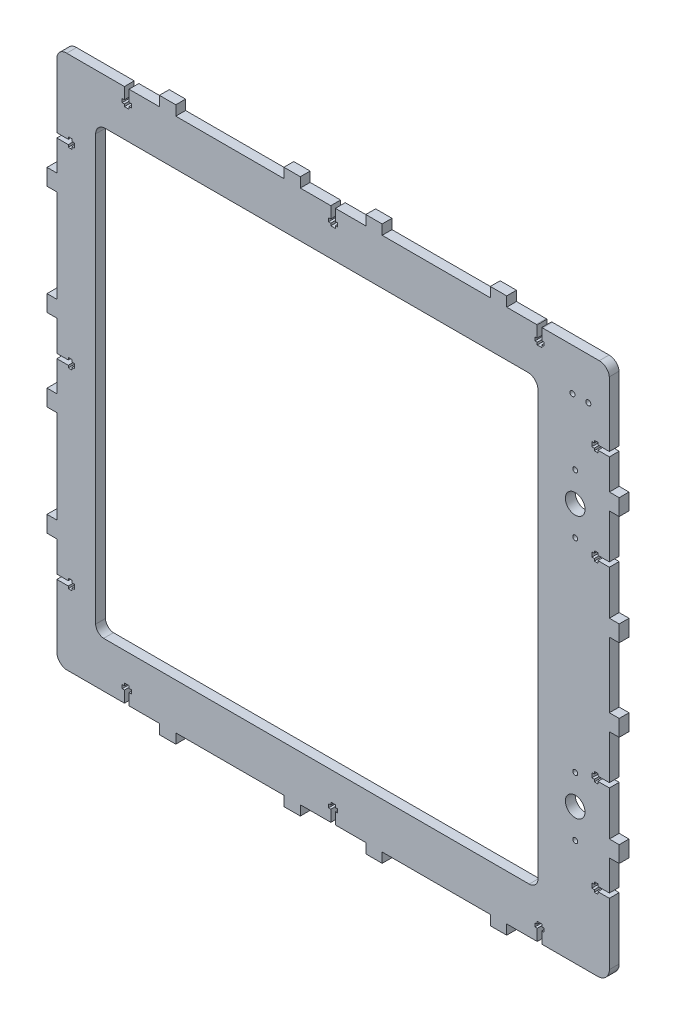
from build123d import *

# Parameters (mm, degrees)
SKETCH_1_R      = 1.5
SKETCH_1_R_2    = 6
SKETCH_1_R_3    = 1.55
EXTRUDE_1_DEPTH = 6


with BuildPart() as part:
    # Эскиз1 → Бобышка-Вытянуть1 (new body)
    with BuildSketch(Plane.XY):
        with BuildLine():
            Line((-163.054352241, 162.505990171), (-127.786008344, 162.499306348))
            Line((-127.786008344, 162.499306348), (-127.787158908, 155.488675728))
            Line((-127.787158908, 155.488675728), (-129.185759975, 155.487133536))
            Line((-129.185759975, 155.487133536), (-129.184934777, 153.288647673))
            Line((-129.184934777, 153.288647673), (-127.786008344, 153.287943858))
            Line((-127.786008344, 153.287943858), (-127.784901099, 151.845327951))
            Line((-127.784901099, 151.845327951), (-124.985164527, 151.845779168))
            Line((-124.985164527, 151.845779168), (-124.984829288, 153.288647673))
            Line((-124.984829288, 153.288647673), (-123.585765673, 153.289035216))
            Line((-123.585765673, 153.289035216), (-123.585937007, 155.488675728))
            Line((-123.585937007, 155.488675728), (-124.985164527, 155.48922606))
            Line((-124.985164527, 155.48922606), (-124.984345552, 162.505990171))
            Line((-124.984345552, 162.505990171), (-106.406283565, 162.506109778))
            Line((-106.406283565, 162.506109778), (-106.406283565, 168.545752435))
            Line((-106.406283565, 168.545752435), (-96.406283565, 168.543859512))
            Line((-96.406283565, 168.543859512), (-96.406283565, 162.506020098))
            Line((-96.406283565, 162.506020098), (-30.331510863, 162.505990171))
            Line((-30.331510863, 162.505990171), (-30.331510863, 168.530758948))
            Line((-30.331510863, 168.530758948), (-20.331510863, 168.528865986))
            Line((-20.331510863, 168.528865986), (-20.331510863, 162.506735802))
            Line((-20.331510863, 162.506735802), (-1.712216453, 162.505990171))
            Line((-1.712216453, 162.505990171), (-1.708948783, 155.490356789))
            Line((-1.708948783, 155.490356789), (-3.108615484, 155.488675728))
            Line((-3.108615484, 155.488675728), (-3.109053192, 153.2895174))
            Line((-3.109053192, 153.2895174), (-1.709631525, 153.288647673))
            Line((-1.709631525, 153.288647673), (-1.708948783, 151.846178834))
            Line((-1.708948783, 151.846178834), (1.089931679, 151.845327951))
            Line((1.089931679, 151.845327951), (1.091895035, 153.287461297))
            Line((1.091895035, 153.287461297), (2.489960994, 153.288647673))
            Line((2.489960994, 153.288647673), (2.491293888, 155.486272288))
            Line((2.491293888, 155.486272288), (1.093632949, 155.488675728))
            Line((1.093632949, 155.488675728), (1.091895035, 162.496160485))
            Line((1.091895035, 162.496160485), (19.663806989, 162.505990171))
            Line((19.663806989, 162.505990171), (19.663806989, 168.52090491))
            Line((19.663806989, 168.52090491), (29.663806989, 168.519014987))
            Line((29.663806989, 168.519014987), (29.663806989, 162.518962699))
            Line((29.663806989, 162.518962699), (95.737938155, 162.505990171))
            Line((95.737938155, 162.505990171), (95.737938155, 168.505911792))
            Line((95.737938155, 168.505911792), (105.737938155, 168.504023152))
            Line((105.737938155, 168.504023152), (105.737938155, 162.524311353))
            Line((105.737938155, 162.524311353), (123.808167212, 162.505990171))
            Line((123.808167212, 162.505990171), (123.97458239, 162.505990171))
            Line((123.97458239, 162.505990171), (124.213834206, 162.505990171))
            Line((124.213834206, 162.505990171), (124.364983924, 162.505990171))
            Line((124.364983924, 162.505990171), (124.366734945, 155.490356789))
            Line((124.366734945, 155.490356789), (122.967068244, 155.488675728))
            Line((122.967068244, 155.488675728), (122.966630536, 153.2895174))
            Line((122.966630536, 153.2895174), (124.366052203, 153.288647673))
            Line((124.366052203, 153.288647673), (124.366734945, 151.846178834))
            Line((124.366734945, 151.846178834), (127.165615407, 151.845327951))
            Line((127.165615407, 151.845327951), (127.167578763, 153.287461297))
            Line((127.167578763, 153.287461297), (128.565644722, 153.288647673))
            Line((128.565644722, 153.288647673), (128.566977616, 155.486272288))
            Line((128.566977616, 155.486272288), (127.169316677, 155.488675728))
            Line((127.169316677, 155.488675728), (127.167578763, 162.496160485))
            Line((127.167578763, 162.496160485), (127.50399944, 162.505990171))
            Line((127.50399944, 162.505990171), (127.664200029, 162.505990171))
            Line((127.664200029, 162.505990171), (162.305983406, 162.505150259))
            ThreePointArc((162.305983406, 162.505150259), (166.415523325, 160.937872534), (168.43795868, 157.032180144))
            Line((168.43795868, 157.032180144), (168.461169098, 117.507879349))
            Line((168.461169098, 117.507879349), (161.461167891, 117.507879349))
            Line((161.461167891, 117.507879349), (161.461167891, 118.907983373))
            Line((161.461167891, 118.907983373), (159.260345309, 118.907983373))
            Line((159.260345309, 118.907983373), (159.261167381, 117.508102408))
            Line((159.261167381, 117.508102408), (157.761167639, 117.507221542))
            Line((157.761167639, 117.507221542), (157.762811385, 114.708138736))
            Line((157.762811385, 114.708138736), (159.262811126, 114.709019602))
            Line((159.262811126, 114.709019602), (159.263633807, 113.308102347))
            Line((159.263633807, 113.308102347), (161.463634217, 113.308049007))
            Line((161.463634217, 113.308049007), (161.463668161, 114.708049007))
            Line((161.463668161, 114.708049007), (168.461169098, 114.706859071))
            Line((168.461169098, 114.706859071), (168.472661293, 96.114498827))
            Line((168.472661293, 96.114498827), (174.453093619, 96.097294997))
            Line((174.453093619, 96.097294997), (174.460484878, 86.097294997))
            Line((174.460484878, 86.097294997), (168.461169098, 86.097294997))
            Line((168.461169098, 86.097294997), (168.461169098, 59.120501996))
            Line((168.461169098, 59.120501996), (161.461167891, 59.120501996))
            Line((161.461167891, 59.120501996), (161.461167891, 60.52060602))
            Line((161.461167891, 60.52060602), (159.260345309, 60.52060602))
            Line((159.260345309, 60.52060602), (159.261167381, 59.120725056))
            Line((159.261167381, 59.120725056), (157.761167639, 59.11984419))
            Line((157.761167639, 59.11984419), (157.762811385, 56.320761383))
            Line((157.762811385, 56.320761383), (159.262811126, 56.32164225))
            Line((159.262811126, 56.32164225), (159.263633807, 54.920724995))
            Line((159.263633807, 54.920724995), (161.463634217, 54.920671654))
            Line((161.463634217, 54.920671654), (161.463668161, 56.320671654))
            Line((161.463668161, 56.320671654), (168.461169098, 56.319481719))
            Line((168.461169098, 56.319481719), (168.461169098, 29.331611336))
            Line((168.461169098, 29.331611336), (174.461169098, 29.315873812))
            Line((174.461169098, 29.315873812), (174.461169098, 19.315873812))
            Line((174.461169098, 19.315873812), (168.461169098, 19.315873812))
            Line((168.461169098, 19.315873812), (168.461169098, -20.682096265))
            Line((168.461169098, -20.682096265), (174.461169098, -20.682096265))
            Line((174.461169098, -20.682096265), (174.461169098, -30.682096265))
            Line((174.461169098, -30.682096265), (168.461169098, -30.682096265))
            Line((168.461169098, -30.682096265), (168.461169098, -57.65789376))
            Line((168.461169098, -57.65789376), (161.461167891, -57.65789376))
            Line((161.461167891, -57.65789376), (161.461167891, -56.257789736))
            Line((161.461167891, -56.257789736), (159.260345309, -56.257789736))
            Line((159.260345309, -56.257789736), (159.261167381, -57.6576707))
            Line((159.261167381, -57.6576707), (157.761167639, -57.658551566))
            Line((157.761167639, -57.658551566), (157.762811385, -60.457634372))
            Line((157.762811385, -60.457634372), (159.262811126, -60.456753506))
            Line((159.262811126, -60.456753506), (159.263633807, -61.857670761))
            Line((159.263633807, -61.857670761), (161.463634217, -61.857724102))
            Line((161.463634217, -61.857724102), (161.463668161, -60.457724102))
            Line((161.463668161, -60.457724102), (168.461169098, -60.458914037))
            Line((168.461169098, -60.458914037), (168.461169098, -87.470948662))
            Line((168.461169098, -87.470948662), (174.461169098, -87.470948662))
            Line((174.461169098, -87.470948662), (174.461169098, -97.470948662))
            Line((174.461169098, -97.470948662), (168.461169098, -97.470948662))
            Line((168.461169098, -97.470948662), (168.461169098, -116.041156567))
            Line((168.461169098, -116.041156567), (161.461167891, -116.041156567))
            Line((161.461167891, -116.041156567), (161.461167891, -114.641052543))
            Line((161.461167891, -114.641052543), (159.260345309, -114.641052543))
            Line((159.260345309, -114.641052543), (159.261167381, -116.040933507))
            Line((159.261167381, -116.040933507), (157.761167639, -116.041814374))
            Line((157.761167639, -116.041814374), (157.762811385, -118.84089718))
            Line((157.762811385, -118.84089718), (159.262811126, -118.840016313))
            Line((159.262811126, -118.840016313), (159.263633807, -120.240933568))
            Line((159.263633807, -120.240933568), (161.463634217, -120.240986909))
            Line((161.463634217, -120.240986909), (161.463668161, -118.840986909))
            Line((161.463668161, -118.840986909), (168.461169098, -118.842176844))
            Line((168.461169098, -118.842176844), (168.46054766, -156.584493379))
            ThreePointArc((168.46054766, -156.584493379), (166.275853581, -161.731495656), (161.058581619, -163.74261324))
            Line((161.058581619, -163.74261324), (127.196370063, -163.74261324))
            Line((127.196370063, -163.74261324), (127.196370063, -156.742612033))
            Line((127.196370063, -156.742612033), (128.596474087, -156.742612033))
            Line((128.596474087, -156.742612033), (128.596474087, -154.541789451))
            Line((128.596474087, -154.541789451), (127.196593122, -154.542611523))
            Line((127.196593122, -154.542611523), (127.195712256, -153.042611781))
            Line((127.195712256, -153.042611781), (124.39662945, -153.044255527))
            Line((124.39662945, -153.044255527), (124.397510316, -154.544255268))
            Line((124.397510316, -154.544255268), (122.996593061, -154.545077949))
            Line((122.996593061, -154.545077949), (122.996539721, -156.745078359))
            Line((122.996539721, -156.745078359), (124.396539721, -156.745112303))
            Line((124.396539721, -156.745112303), (124.395349786, -163.74261324))
            Line((124.395349786, -163.74261324), (105.737938155, -163.74261324))
            Line((105.737938155, -163.74261324), (105.737938155, -169.74305922))
            Line((105.737938155, -169.74305922), (95.737938155, -169.745257606))
            Line((95.737938155, -169.745257606), (95.737938155, -163.74261324))
            Line((95.737938155, -163.74261324), (29.663806989, -163.74261324))
            Line((29.663806989, -163.74261324), (29.663806989, -169.76003815))
            Line((29.663806989, -169.76003815), (19.663806989, -169.74261324))
            Line((19.663806989, -169.74261324), (19.663806989, -163.74261324))
            Line((19.663806989, -163.74261324), (1.127420747, -163.74261324))
            Line((1.127420747, -163.74261324), (1.127420747, -156.742612033))
            Line((1.127420747, -156.742612033), (2.527524771, -156.742612033))
            Line((2.527524771, -156.742612033), (2.527524771, -154.541789451))
            Line((2.527524771, -154.541789451), (1.127643807, -154.542611523))
            Line((1.127643807, -154.542611523), (1.126762941, -153.042611781))
            Line((1.126762941, -153.042611781), (-1.672319865, -153.044255527))
            Line((-1.672319865, -153.044255527), (-1.671438999, -154.544255268))
            Line((-1.671438999, -154.544255268), (-3.072356254, -154.545077949))
            Line((-3.072356254, -154.545077949), (-3.072409595, -156.745078359))
            Line((-3.072409595, -156.745078359), (-1.672409595, -156.745112303))
            Line((-1.672409595, -156.745112303), (-1.67359953, -163.74261324))
            Line((-1.67359953, -163.74261324), (-20.331510863, -163.74261324))
            Line((-20.331510863, -163.74261324), (-20.331510863, -169.74261324))
            Line((-20.331510863, -169.74261324), (-30.331510863, -169.74261324))
            Line((-30.331510863, -169.74261324), (-30.331510863, -163.74261324))
            Line((-30.331510863, -163.74261324), (-96.406283565, -163.74261324))
            Line((-96.406283565, -163.74261324), (-96.406283565, -169.74261324))
            Line((-96.406283565, -169.74261324), (-106.406283565, -169.74261324))
            Line((-106.406283565, -169.74261324), (-106.406283565, -163.74261324))
            Line((-106.406283565, -163.74261324), (-124.943599267, -163.74261324))
            Line((-124.943599267, -163.74261324), (-124.943599267, -156.742612033))
            Line((-124.943599267, -156.742612033), (-123.543495243, -156.742612033))
            Line((-123.543495243, -156.742612033), (-123.543495243, -154.541789451))
            Line((-123.543495243, -154.541789451), (-124.943376207, -154.542611523))
            Line((-124.943376207, -154.542611523), (-124.944257074, -153.042611781))
            Line((-124.944257074, -153.042611781), (-127.74333988, -153.044255527))
            Line((-127.74333988, -153.044255527), (-127.742459013, -154.544255268))
            Line((-127.742459013, -154.544255268), (-129.143376268, -154.545077949))
            Line((-129.143376268, -154.545077949), (-129.143429609, -156.745078359))
            Line((-129.143429609, -156.745078359), (-127.743429609, -156.745112303))
            Line((-127.743429609, -156.745112303), (-127.744619544, -163.74261324))
            Line((-127.744619544, -163.74261324), (-164.010580235, -163.74261324))
            ThreePointArc((-164.010580235, -163.74261324), (-167.651465832, -161.309829433), (-169.073914963, -157.168437946))
            Line((-169.073914963, -157.168437946), (-169.078575402, -118.896065743))
            Line((-169.078575402, -118.896065743), (-162.078574195, -118.896065743))
            Line((-162.078574195, -118.896065743), (-162.078574195, -120.296169767))
            Line((-162.078574195, -120.296169767), (-159.877751612, -120.296169767))
            Line((-159.877751612, -120.296169767), (-159.878573685, -118.896288803))
            Line((-159.878573685, -118.896288803), (-158.378573943, -118.895407936))
            Line((-158.378573943, -118.895407936), (-158.380217688, -116.09632513))
            Line((-158.380217688, -116.09632513), (-159.88021743, -116.097205997))
            Line((-159.88021743, -116.097205997), (-159.88104011, -114.696288742))
            Line((-159.88104011, -114.696288742), (-162.081040521, -114.696235401))
            Line((-162.081040521, -114.696235401), (-162.081074465, -116.096235401))
            Line((-162.081074465, -116.096235401), (-169.078575402, -116.095045466))
            Line((-169.078575402, -116.095045466), (-169.074467884, -97.470948662))
            Line((-169.074467884, -97.470948662), (-175.078575402, -97.470948662))
            Line((-175.078575402, -97.470948662), (-175.078575402, -87.470948662))
            Line((-175.078575402, -87.470948662), (-169.072240872, -87.470948662))
            Line((-169.072240872, -87.470948662), (-169.077597241, -30.682096265))
            Line((-169.077597241, -30.682096265), (-175.078575402, -30.682096265))
            Line((-175.078575402, -30.682096265), (-175.078575402, -20.682096265))
            Line((-175.078575402, -20.682096265), (-169.077941566, -20.682096265))
            Line((-169.077941566, -20.682096265), (-169.078575402, -2.122457289))
            Line((-169.078575402, -2.122457289), (-162.078574195, -2.122457289))
            Line((-162.078574195, -2.122457289), (-162.078574195, -3.522561313))
            Line((-162.078574195, -3.522561313), (-159.877751612, -3.522561313))
            Line((-159.877751612, -3.522561313), (-159.878573685, -2.122680349))
            Line((-159.878573685, -2.122680349), (-158.378573943, -2.121799482))
            Line((-158.378573943, -2.121799482), (-158.380217688, 0.677283324))
            Line((-158.380217688, 0.677283324), (-159.88021743, 0.676402457))
            Line((-159.88021743, 0.676402457), (-159.88104011, 2.077319712))
            Line((-159.88104011, 2.077319712), (-162.081040521, 2.077373053))
            Line((-162.081040521, 2.077373053), (-162.081074465, 0.677373053))
            Line((-162.081074465, 0.677373053), (-169.078575402, 0.678562988))
            Line((-169.078575402, 0.678562988), (-169.078575402, 19.315873812))
            Line((-169.078575402, 19.315873812), (-175.078575402, 19.315873812))
            Line((-175.078575402, 19.315873812), (-175.078575402, 29.315873812))
            Line((-175.078575402, 29.315873812), (-169.078575402, 29.315873812))
            Line((-169.078575402, 29.315873812), (-169.078575402, 86.097294997))
            Line((-169.078575402, 86.097294997), (-175.078575402, 86.097294997))
            Line((-175.078575402, 86.097294997), (-175.078575402, 96.097294997))
            Line((-175.078575402, 96.097294997), (-169.078575402, 96.097294997))
            Line((-169.078575402, 96.097294997), (-169.078575402, 114.642594524))
            Line((-169.078575402, 114.642594524), (-162.078574195, 114.624908871))
            Line((-162.078574195, 114.624908871), (-162.078574195, 113.224804847))
            Line((-162.078574195, 113.224804847), (-159.877751612, 113.224804847))
            Line((-159.877751612, 113.224804847), (-159.878573685, 114.624685811))
            Line((-159.878573685, 114.624685811), (-158.378573943, 114.625566677))
            Line((-158.378573943, 114.625566677), (-158.380217688, 117.424649483))
            Line((-158.380217688, 117.424649483), (-159.88021743, 117.423768617))
            Line((-159.88021743, 117.423768617), (-159.88104011, 118.824685872))
            Line((-159.88104011, 118.824685872), (-162.081040521, 118.824739212))
            Line((-162.081040521, 118.824739212), (-162.081074465, 117.424739213))
            Line((-162.081074465, 117.424739213), (-169.078575402, 117.425929148))
            Line((-169.078575402, 117.425929148), (-169.074406174, 156.719263354))
            ThreePointArc((-169.074406174, 156.719263354), (-167.295044129, 160.892913431), (-163.054352241, 162.505990171))
        make_face()
        with Locations((147.617787675, 97.427434798)):
            Circle(SKETCH_1_R, mode=Mode.SUBTRACT)
        with Locations((147.623613618, 61.428108555)):
            Circle(SKETCH_1_R, mode=Mode.SUBTRACT)
        with Locations((147.60624471, 79.417533942)):
            Circle(SKETCH_1_R_2, mode=Mode.SUBTRACT)
        with Locations((147.623613618, -98.702331466)):
            Circle(SKETCH_1_R, mode=Mode.SUBTRACT)
        with Locations((147.60624471, -80.71290608)):
            Circle(SKETCH_1_R_2, mode=Mode.SUBTRACT)
        with Locations((147.617787675, -62.703005224)):
            Circle(SKETCH_1_R, mode=Mode.SUBTRACT)
        with Locations((145.913739672, 136.873986919)):
            Circle(SKETCH_1_R_3, mode=Mode.SUBTRACT)
        with Locations((155.613739672, 136.873986919)):
            Circle(SKETCH_1_R_3, mode=Mode.SUBTRACT)
        with BuildLine():
            Line((-145.368552653, 128.65685498), (-145.368552653, -130.722901869))
            ThreePointArc((-145.368552653, -130.722901869), (-143.887433973, -134.163156936), (-140.512093137, -135.786776877))
            Line((-140.512093137, -135.786776877), (119.483067879, -135.796396811))
            ThreePointArc((119.483067879, -135.796396811), (123.221101581, -134.274789613), (124.834118393, -130.575281377))
            Line((124.834118393, -130.575281377), (124.834118393, 128.808511187))
            ThreePointArc((124.834118393, 128.808511187), (122.879688117, 132.856095048), (118.698567938, 134.505630396))
            Line((118.698567938, 134.505630396), (-139.370489437, 134.506335455))
            ThreePointArc((-139.370489437, 134.506335455), (-143.602142601, 132.845526612), (-145.368552653, 128.65685498))
        make_face(mode=Mode.SUBTRACT)
    extrude(amount=EXTRUDE_1_DEPTH)


solid = part.part
